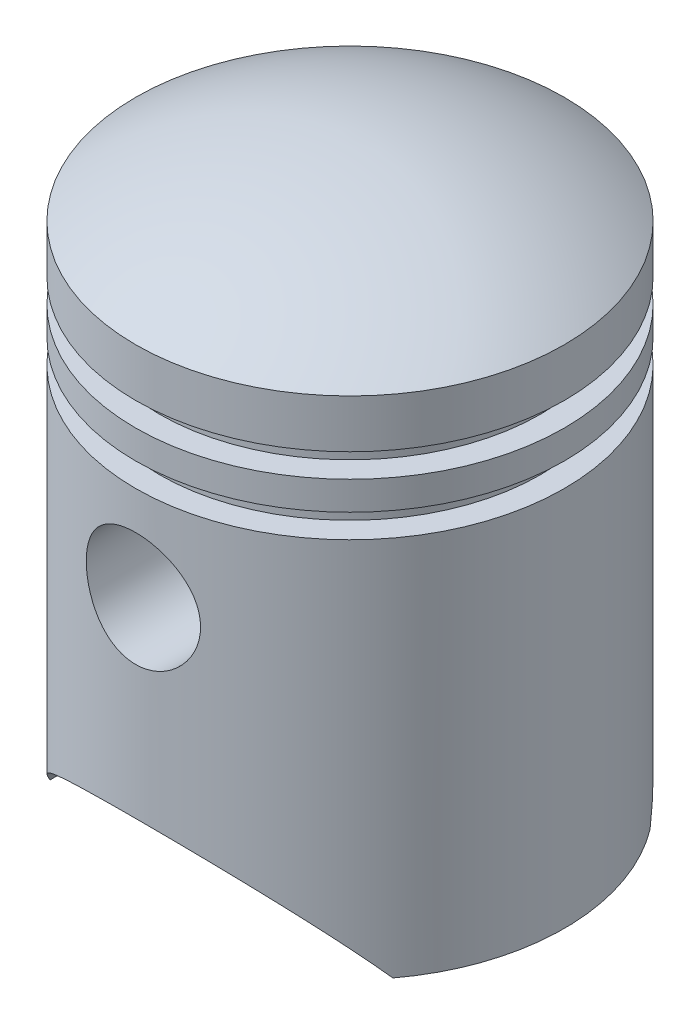
from build123d import *

# Parameters (mm, degrees)
SZKIC3_W                         = 2.5
SZKIC3_H                         = 2.5
SZYK_LINIOWY1_COUNT              = 2
SZYK_LINIOWY1_PITCH              = 5.5
WYTNIJ_WYCI_GNI_CIE1_DEPTH       = 68.915388536
WYTNIJ_WYCI_GNI_CIE1_DEPTH_BACK  = 68.915388536
WYTNIJ_WYCI_GNI_CIE2_DEPTH       = 68.915388602
WYTNIJ_WYCI_GNI_CIE2_DEPTH_BACK  = 68.915388602
SZKIC5_R                         = 6
DODANIE_WYCI_GNI_CIE1_REACH      = 79.915
DODANIE_WYCI_GNI_CIE1_END_RADIUS = 20.5
DODANIE_WYCI_GNI_CIE1_START      = 10
SZKIC6_R                         = 7.5
SZKIC6_R_2                       = 6


# Read off the part's stored shape, not the designer's step: Skorupa1
with BuildPart() as part:
    # Szkic2 → Obrót1 (revolve)
    with BuildSketch(Plane.XY):
        with BuildLine():
            Line((0, 0), (0, 60))
            ThreePointArc((0, 60), (11.771243445, 58.228756555), (22.5, 53.071891388))
            Line((22.5, 53.071891388), (22.5, 0))
            Line((22.5, 0), (0, 0))
        make_face()
    revolve(axis=Axis((0, 0, 0), (0, 1, 0)))

    # Szkic3 → Wycięcie-obrót1 (revolve, cut)
    with BuildSketch(Plane.XY, mode=Mode.PRIVATE) as wyci_cie_obr_t1_sk:
        with Locations((21.25, 41.25)):
            Rectangle(SZKIC3_W, SZKIC3_H)
    wyci_cie_obr_t1 = revolve(wyci_cie_obr_t1_sk.sketch.rotate(Axis((0, 69.339068265, 0), (0, 1, 0)), 90), axis=Axis((0, 69.339068265, 0), (0, 1, 0)), mode=Mode.SUBTRACT)

    # Szyk liniowy1: Wycięcie-obrót1 ×2
    with Locations(*[(0, i * SZYK_LINIOWY1_PITCH, 0) for i in range(1, SZYK_LINIOWY1_COUNT)]):
        add(wyci_cie_obr_t1, mode=Mode.SUBTRACT)

    # Skorupa1 outline → Skorupa1 (revolve, cut)
    with BuildSketch(Plane.XY):
        with BuildLine():
            Line((0, 0), (20.5, 0))
            Line((20.5, 0), (20.5, 38))
            Line((20.5, 38), (18, 38))
            Line((18, 38), (18, 50))
            Line((18, 50), (20.5, 50))
            Line((20.5, 50), (20.500000011, 51.996093505))
            ThreePointArc((20.500000011, 51.996093505), (10.680553516, 56.468147425), (0, 58))
            Line((0, 58), (0, 0))
        make_face()
    revolve(axis=Axis((0, 0, 0), (0, 1, 0)), mode=Mode.SUBTRACT)

    # Szkic4 → Wytnij-wyciągnięcie1 (cut, two sides: drawn at the far end of the back side and taken through both)
    with BuildSketch(Plane.XY.offset(-WYTNIJ_WYCI_GNI_CIE1_DEPTH_BACK)):
        with BuildLine():
            Line((-99.770112831, -131.416252764), (-18, 0))
            ThreePointArc((-18, 0), (0, 10), (18, 0))
            Line((18, 0), (99.770112831, -131.416252764))
            Line((99.770112831, -131.416252764), (99.770112831, -440.974537052))
            Line((99.770112831, -440.974537052), (-99.770112831, -440.974537052))
            Line((-99.770112831, -440.974537052), (-99.770112831, -131.416252764))
        make_face()
    extrude(amount=WYTNIJ_WYCI_GNI_CIE1_DEPTH + WYTNIJ_WYCI_GNI_CIE1_DEPTH_BACK, mode=Mode.SUBTRACT)

    # Szkic5 → Wytnij-wyciągnięcie2 (cut, two sides: drawn at the far end of the back side and taken through both)
    with BuildSketch(Plane.XY.offset(-WYTNIJ_WYCI_GNI_CIE2_DEPTH_BACK)):
        with Locations((0, 30)):
            Circle(SZKIC5_R)
    extrude(amount=WYTNIJ_WYCI_GNI_CIE2_DEPTH + WYTNIJ_WYCI_GNI_CIE2_DEPTH_BACK, mode=Mode.SUBTRACT)

    # Dodanie-wyciągnięcie1: up to this cylinder (the profile starts inside it)
    dodanie_wyci_gni_cie1_end = Plane(origin=(0, 30, 0), z_dir=(0, -1, 0)) * Cylinder(DODANIE_WYCI_GNI_CIE1_END_RADIUS, 201.83, mode=Mode.PRIVATE)
    # Szkic6 → Dodanie-wyciągnięcie1 (add, up to the surface)
    with BuildSketch(Plane.XY.offset(DODANIE_WYCI_GNI_CIE1_START), mode=Mode.PRIVATE) as dodanie_wyci_gni_cie1_sk1:
        with Locations(Location((0, 30, 0), (0, 0, 180))):
            Circle(SZKIC6_R)
        with Locations((0, 30)):
            Circle(SZKIC6_R_2, mode=Mode.SUBTRACT)
    dodanie_wyci_gni_cie1_tool1 = extrude(dodanie_wyci_gni_cie1_sk1.sketch, amount=DODANIE_WYCI_GNI_CIE1_REACH, mode=Mode.PRIVATE) & dodanie_wyci_gni_cie1_end
    dodanie_wyci_gni_cie1 = dodanie_wyci_gni_cie1_tool1.solids().sort_by_distance((7.287868, 30, 10))[0]
    add(dodanie_wyci_gni_cie1)

    # Lustro1: Dodanie-wyciągnięcie1 across plane
    add(dodanie_wyci_gni_cie1.mirror(Plane.XY))


solid = part.part
